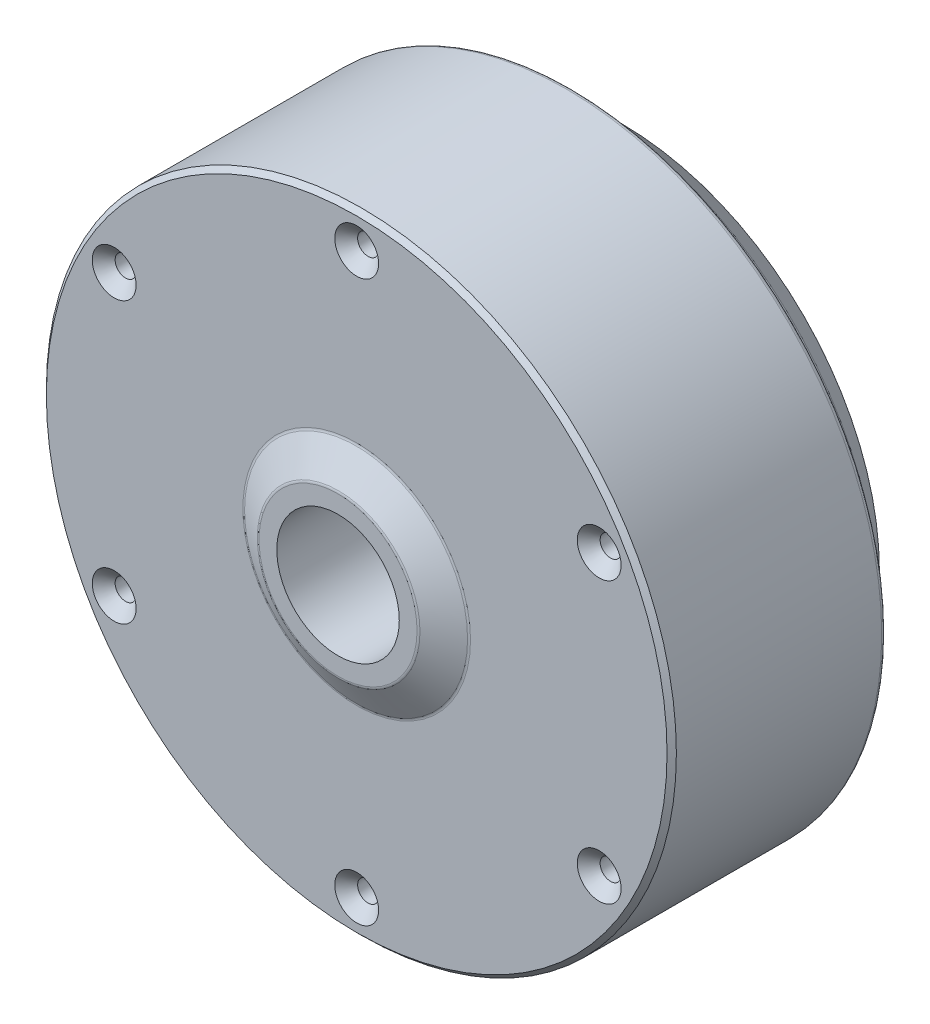
from build123d import *

# Parameters (mm, degrees)
SKETCH1_R           = 67.5
SKETCH1_R_2         = 13.125
SKETCH1_R_3         = 63.25
SKETCH1_R_4         = 55
BOSS_EXTRUDE1_DEPTH = 46
BOSS_EXTRUDE4_START = -11
SKETCH1_3_R         = 55
SKETCH1_3_R_2       = 13.125
BOSS_EXTRUDE4_DEPTH = 11
CIRPATTERN1_COUNT   = 6
CHAMFER1_SIZE       = 1
BOSS_EXTRUDE5_START = -1
SKETCH1_4_R         = 63.25
SKETCH1_4_R_2       = 55
BOSS_EXTRUDE5_DEPTH = 1
CHAMFER5_SIZE       = 10
CHAMFER6_SIZE       = 2.5
FILLET6_R           = 1
SKETCH6_R           = 24.125
SKETCH6_R_2         = 13.125
BOSS_EXTRUDE6_DEPTH = 4
CHAMFER7_SIZE2      = 4
CHAMFER7_SIZE       = 6.92820323


with BuildPart() as part:
    # Sketch1 → Boss-Extrude1 (new body)
    # profile 1 of 3: a face of its own
    with BuildSketch(Plane.XY):
        Circle(SKETCH1_R)
        Circle(SKETCH1_R_2, mode=Mode.SUBTRACT)
    # profile 2 of 3: a face of its own
    with BuildSketch(Plane.XY):
        Circle(SKETCH1_R_3)
        Circle(SKETCH1_R_2, mode=Mode.SUBTRACT)
    # profile 3 of 3: a face of its own
    with BuildSketch(Plane.XY):
        Circle(SKETCH1_R_4)
        Circle(SKETCH1_R_2, mode=Mode.SUBTRACT)
    extrude(amount=BOSS_EXTRUDE1_DEPTH)

    # Sketch1<3> → Boss-Extrude4 (add)
    with BuildSketch(Plane.XY.offset(BOSS_EXTRUDE4_START)):
        Circle(SKETCH1_3_R)
        Circle(SKETCH1_3_R_2, mode=Mode.SUBTRACT)
    extrude(amount=BOSS_EXTRUDE4_DEPTH)

    # Sketch4 → CSK for M4 Flat Head Machine Screw1 (revolve, cut)
    with BuildSketch(Plane(origin=(0, 60, 46), x_dir=(0, -1, 0), z_dir=(1, 0, 0))):
        Polygon((0, 0), (0, 12), (2.25, 10.648063607), (2.25, 2.45), (4.7, 0), align=None)
    csk_for_m4_flat_head_machine_screw1 = revolve(axis=Axis((0, 60, 52.35), (0, 0, -1)), mode=Mode.SUBTRACT)

    # CirPattern1: CSK for M4 Flat Head Machine Screw1 ×6 about axis
    cirpattern1_axis = Axis((0, 0, 0), (0, 0, 1))
    for i in range(1, CIRPATTERN1_COUNT):
        add(csk_for_m4_flat_head_machine_screw1.rotate(cirpattern1_axis, i * 360 / CIRPATTERN1_COUNT), mode=Mode.SUBTRACT)

    # Chamfer1
    chamfer1_edges = [part.edges().sort_by_distance(p)[0] for p in [
        (-67.5, 0, 46),
    ]]
    chamfer(chamfer1_edges, length=CHAMFER1_SIZE)

    # Sketch1<4> → Boss-Extrude5 (add)
    with BuildSketch(Plane.XY.offset(BOSS_EXTRUDE5_START)):
        Circle(SKETCH1_4_R)
        Circle(SKETCH1_4_R_2, mode=Mode.SUBTRACT)
    extrude(amount=BOSS_EXTRUDE5_DEPTH)

    # Chamfer5
    # the kernel refuses this chamfer: 10 mm, written as the material it adds along each edge
    with BuildSketch(Plane(origin=(0, 0, -1), x_dir=(1, 0, 0), z_dir=(0, -1, 0))) as chamfer5_piece_1_section:
        Polygon((55 + CHAMFER5_SIZE, 0), (55, -CHAMFER5_SIZE), (55, 0), align=None)
    chamfer5_piece_1 = revolve(axis=Axis((0, 0, -1), (0, 0, 1)), mode=Mode.PRIVATE)
    chamfer5_piece_1 = chamfer5_piece_1 & Plane(origin=(0, 0, -1), x_dir=(1, 0, 0), z_dir=(0, 0, -1)) * Cylinder(63.25, 260, mode=Mode.PRIVATE)
    chamfer5_piece_1 = split(chamfer5_piece_1, bisect_by=Plane(origin=(0, 0, -11), z_dir=(0, 0, 1)), keep=Keep.TOP, mode=Mode.PRIVATE)
    add(chamfer5_piece_1)

    # Chamfer6
    chamfer6_edges = [part.edges().sort_by_distance(p)[0] for p in [
        (-13.125, 0, -11),
    ]]
    chamfer(chamfer6_edges, length=CHAMFER6_SIZE)

    # Fillet6
    fillet6_edges = [part.edges().sort_by_distance(p)[0] for p in [
        (-55, 0, -11),
        (-67.5, 0, 0),
        (-63.25, 0, 0),
        (-63.25, 0, -2.75),
        (-15.625, 0, -11),
        (-13.125, 0, -8.5),
    ]]
    fillet(fillet6_edges, radius=FILLET6_R)

    # Sketch6 → Boss-Extrude6 (add)
    with BuildSketch(Plane.XY.offset(46)):
        Circle(SKETCH6_R)
        Circle(SKETCH6_R_2, mode=Mode.SUBTRACT)
    extrude(amount=BOSS_EXTRUDE6_DEPTH)

    # Chamfer7
    chamfer7_edges = [part.edges().sort_by_distance(p)[0] for p in [
        (-24.125, 0, 50),
    ]]
    chamfer7_side = [part.faces().sort_by_distance(p)[0] for p in [
        (-24.045, 0, 50),
    ]]
    chamfer(chamfer7_edges, length=CHAMFER7_SIZE - 0.0001, length2=CHAMFER7_SIZE2 - 0.0001, reference=chamfer7_side[0])  # a hair under: the kernel refuses the full size

    # Fillet8: read off the stored shape, not the designer's step
    # Fillet8 outline → Fillet8 (revolve, cut)
    with BuildSketch(Plane.XZ):
        with BuildLine():
            ThreePointArc((16.928847577, 50), (17.187666622, 49.965925826), (17.428847577, 49.866025404))
            Line((17.428847577, 49.866025404), (17.428847577, 50))
            Line((17.428847577, 50), (16.928847577, 50))
        make_face()
    revolve(axis=Axis((0, 0, 0), (0, 0, 1)), mode=Mode.SUBTRACT)

    # Fillet8 2 outline → Fillet8 2 (revolve)
    with BuildSketch(Plane.XZ):
        with BuildLine():
            ThreePointArc((24.392949192, 46), (24.134130147, 46.034074174), (23.892949192, 46.133974596))
            Line((23.892949192, 46.133974596), (23.892949192, 46))
            Line((23.892949192, 46), (24.392949192, 46))
        make_face()
    revolve(axis=Axis((0, 0, 0), (0, 0, 1)))


solid = part.part
